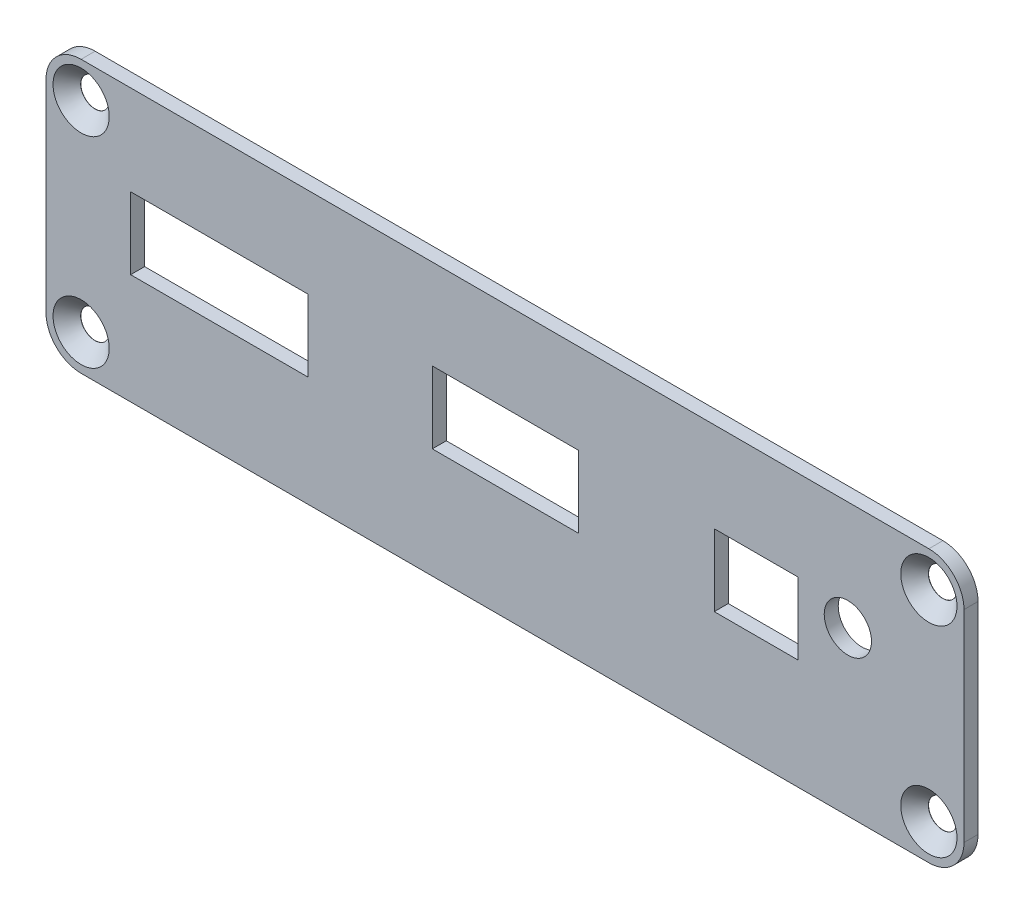
from build123d import *

# Parameters (mm, degrees)
SKETCH1_W                                      = 102.87
SKETCH1_H                                      = 30.48
BOSS_EXTRUDE1_DEPTH                            = 1.57
FILLET1_R                                      = 3.935
CSK_FOR_M3_FLAT_HEAD_MACHINE_SCREW1_AT_2_COUNT = 2
CSK_FOR_M3_FLAT_HEAD_MACHINE_SCREW1_AT_2_PITCH = 22.479
CSK_FOR_M3_FLAT_HEAD_MACHINE_SCREW1_AT_3_COUNT = 2
CSK_FOR_M3_FLAT_HEAD_MACHINE_SCREW1_AT_3_PITCH = 94.996
CSK_FOR_M3_FLAT_HEAD_MACHINE_SCREW1_AT_4_COUNT = 2
CSK_FOR_M3_FLAT_HEAD_MACHINE_SCREW1_AT_4_PITCH = 97.619390784
SKETCH6_R                                      = 2.15
SKETCH6_W                                      = 8.4
SKETCH6_H                                      = 7.55
SKETCH6_W_2                                    = 15.4
SKETCH6_W_3                                    = 18.9
CUT_EXTRUDE1_DEPTH                             = 108.302060558
MOVE_FACE1_BY                                  = 0.5
MOVE_FACE1_2_BY                                = 0.5
MOVE_FACE1_3_BY                                = 0.5
MOVE_FACE1_4_BY                                = 0.5
MOVE_FACE1_5_BY                                = 0.5
MOVE_FACE1_6_BY                                = 0.5
MOVE_FACE1_7_BY                                = 0.5
MOVE_FACE1_8_BY                                = 0.5
MOVE_FACE1_9_BY                                = 0.5
MOVE_FACE1_10_BY                               = 0.5


with BuildPart() as part:
    # Sketch1 → Boss-Extrude1 (new body)
    with BuildSketch(Plane.XY):
        with Locations((51.435, 15.24)):
            Rectangle(SKETCH1_W, SKETCH1_H)
    extrude(amount=BOSS_EXTRUDE1_DEPTH)

    # Fillet1
    fillet1_edges = [part.edges().sort_by_distance(p)[0] for p in [
        (0, 0, 0.785),
        (102.87, 0, 0.785),
        (102.87, 30.48, 0.785),
        (0, 30.48, 0.785),
    ]]
    fillet(fillet1_edges, radius=FILLET1_R)

    # Sketch4 → CSK for M3 Flat Head Machine Screw1 (revolve, cut)
    with BuildSketch(Plane(origin=(3.937, 26.4795, 1.57), x_dir=(0, -1, 0), z_dir=(1, 0, 0))):
        Polygon((0, 0), (0, 1.57), (1.6, 1.57), (1.6, 1.55), (3.15, 0), align=None)
    csk_for_m3_flat_head_machine_screw1 = revolve(axis=Axis((3.937, 26.4795, 7.92), (0, 0, -1)), mode=Mode.SUBTRACT)

    # CSK for M3 Flat Head Machine Screw1 at 2: CSK for M3 Flat Head Machine Screw1 ×2
    with Locations(*[(0, -i * CSK_FOR_M3_FLAT_HEAD_MACHINE_SCREW1_AT_2_PITCH, 0) for i in range(1, CSK_FOR_M3_FLAT_HEAD_MACHINE_SCREW1_AT_2_COUNT)]):
        add(csk_for_m3_flat_head_machine_screw1, mode=Mode.SUBTRACT)

    # CSK for M3 Flat Head Machine Screw1 at 3: CSK for M3 Flat Head Machine Screw1 ×2
    with Locations(*[(i * CSK_FOR_M3_FLAT_HEAD_MACHINE_SCREW1_AT_3_PITCH, 0, 0) for i in range(1, CSK_FOR_M3_FLAT_HEAD_MACHINE_SCREW1_AT_3_COUNT)]):
        add(csk_for_m3_flat_head_machine_screw1, mode=Mode.SUBTRACT)

    # CSK for M3 Flat Head Machine Screw1 at 4: CSK for M3 Flat Head Machine Screw1 ×2
    with Locations(*[Vector(0.9731263352215668, -0.23027187344146696, 0) * (i * CSK_FOR_M3_FLAT_HEAD_MACHINE_SCREW1_AT_4_PITCH) for i in range(1, CSK_FOR_M3_FLAT_HEAD_MACHINE_SCREW1_AT_4_COUNT)]):
        add(csk_for_m3_flat_head_machine_screw1, mode=Mode.SUBTRACT)

    # Sketch6 → Cut-Extrude1 (cut, through all)
    with BuildSketch(Plane.XY.offset(1.57)):
        with Locations((89.85634518, 18.26400981)):
            Circle(SKETCH6_R)
        with Locations((79.585, 16.1245)):
            Rectangle(SKETCH6_W, SKETCH6_H)
        with Locations((51.49, 16.1245)):
            Rectangle(SKETCH6_W_2, SKETCH6_H)
        with Locations((19.43498277, 16.1245)):
            Rectangle(SKETCH6_W_3, SKETCH6_H)
    extrude(amount=-CUT_EXTRUDE1_DEPTH, mode=Mode.SUBTRACT)

    # Move Face1: a curved face moved inward by 0.5
    add(Solid.thicken(part.faces().sort_by_distance((87.70634518, 18.26400981, 0.785))[0], -MOVE_FACE1_BY), mode=Mode.SUBTRACT)

    # Move Face1 2: a face moved inward by 0.5
    extrude(part.faces().sort_by_distance((19.43498277, 19.8995, 0.785))[0], amount=MOVE_FACE1_2_BY, dir=(0, 1, 0), mode=Mode.SUBTRACT)

    # Move Face1 3: a face moved inward by 0.5
    extrude(part.faces().sort_by_distance((51.49, 19.8995, 0.785))[0], amount=MOVE_FACE1_3_BY, dir=(0, 1, 0), mode=Mode.SUBTRACT)

    # Move Face1 4: a face moved inward by 0.5
    extrude(part.faces().sort_by_distance((79.585, 19.8995, 0.785))[0], amount=MOVE_FACE1_4_BY, dir=(0, 1, 0), mode=Mode.SUBTRACT)

    # Move Face1 5: a face moved inward by 0.5
    extrude(part.faces().sort_by_distance((75.385, 16.1245, 0.785))[0], amount=MOVE_FACE1_5_BY, dir=(-1, 0, 0), mode=Mode.SUBTRACT)

    # Move Face1 6: a face moved inward by 0.5
    extrude(part.faces().sort_by_distance((83.785, 16.1245, 0.785))[0], amount=MOVE_FACE1_6_BY, dir=(1, 0, 0), mode=Mode.SUBTRACT)

    # Move Face1 7: a face moved inward by 0.5
    extrude(part.faces().sort_by_distance((59.19, 16.1245, 0.785))[0], amount=MOVE_FACE1_7_BY, dir=(1, 0, 0), mode=Mode.SUBTRACT)

    # Move Face1 8: a face moved inward by 0.5
    extrude(part.faces().sort_by_distance((28.88498277, 16.1245, 0.785))[0], amount=MOVE_FACE1_8_BY, dir=(1, 0, 0), mode=Mode.SUBTRACT)

    # Move Face1 9: a face moved inward by 0.5
    extrude(part.faces().sort_by_distance((9.98498277, 16.1245, 0.785))[0], amount=MOVE_FACE1_9_BY, dir=(-1, 0, 0), mode=Mode.SUBTRACT)

    # Move Face1 10: a face moved inward by 0.5
    extrude(part.faces().sort_by_distance((43.79, 16.1245, 0.785))[0], amount=MOVE_FACE1_10_BY, dir=(-1, 0, 0), mode=Mode.SUBTRACT)


solid = part.part
